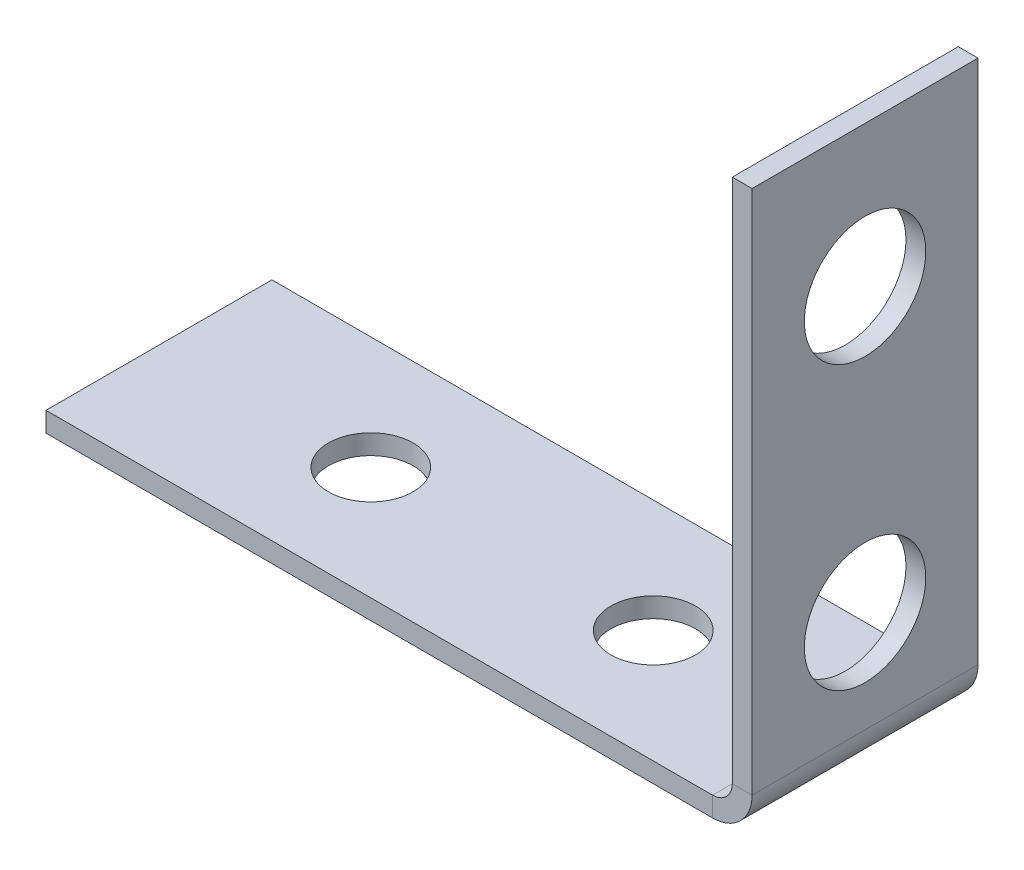
from build123d import *

# Parameters (mm, degrees)
BASE_FLANGE1_DEPTH = 8
SKETCH6_R          = 1.5
CUT_EXTRUDE1_DEPTH = 0.7
SKETCH7_R          = 2.15
CUT_EXTRUDE2_DEPTH = 0.7


# Sheet-metal steps are written as plain solids
with BuildPart() as part:
    # Sketch1 → Base-Flange1 (new body)
    with BuildSketch(Plane.XY):
        with BuildLine():
            Line((0, 0), (23.6, 0))
            ThreePointArc((23.6, 0), (24.589949494, 0.410050506), (25, 1.4))
            Line((25, 1.4), (25, 20))
            Line((25, 20), (24.3, 20))
            Line((24.3, 20), (24.3, 1.4))
            ThreePointArc((24.3, 1.4), (24.094974747, 0.905025253), (23.6, 0.7))
            Line((23.6, 0.7), (0, 0.7))
            Line((0, 0.7), (0, 0))
        make_face()
    extrude(amount=BASE_FLANGE1_DEPTH)

    # Sketch6 → Cut-Extrude1 (cut)
    with BuildSketch(Plane(origin=(0, 0.7, 0), x_dir=(1, 0, 0), z_dir=(0, 1, 0))):
        with Locations(Location((7.5, -4, 0), (0, 0, 270))):
            Circle(SKETCH6_R)
        with Locations(Location((17.5, -4, 0), (0, 0, 270))):
            Circle(SKETCH6_R)
    extrude(amount=-CUT_EXTRUDE1_DEPTH, mode=Mode.SUBTRACT)

    # Sketch7 → Cut-Extrude2 (cut)
    with BuildSketch(Plane(origin=(25, 0, 0), x_dir=(0, 0, -1), z_dir=(1, 0, 0))):
        with Locations((-4, 15)):
            Circle(SKETCH7_R)
        with Locations((-4, 5)):
            Circle(SKETCH7_R)
    extrude(amount=-CUT_EXTRUDE2_DEPTH, mode=Mode.SUBTRACT)


solid = part.part
